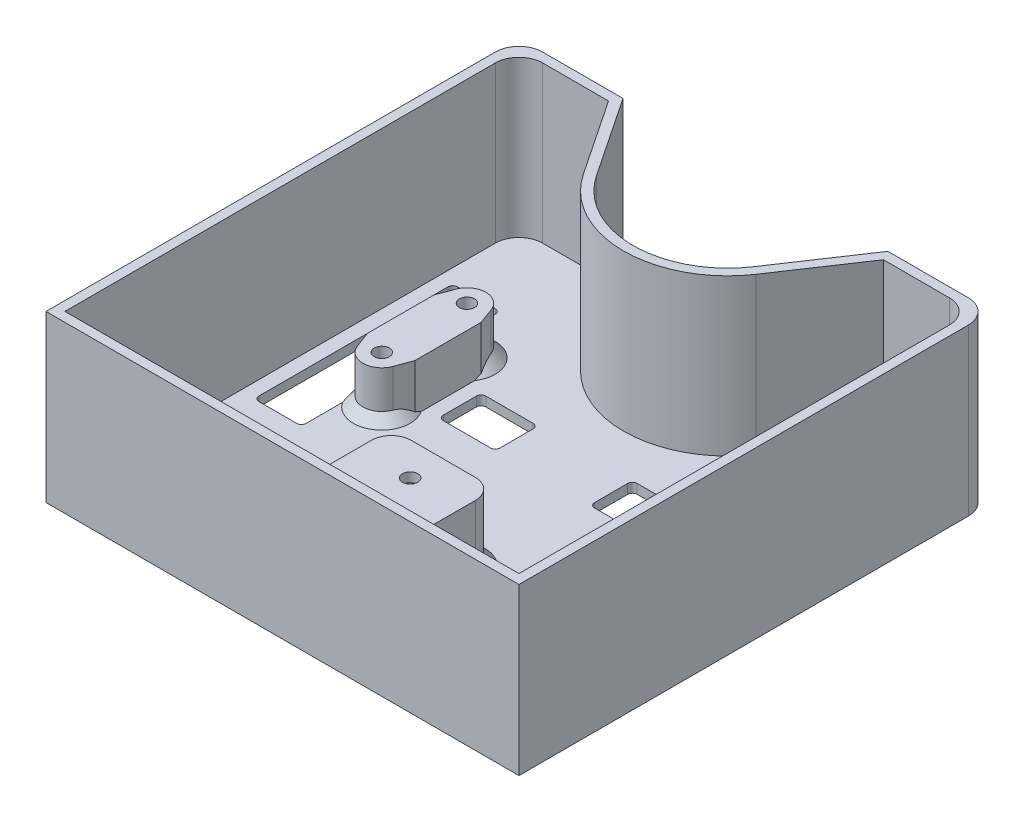
from build123d import *

# Parameters (mm, degrees)
AUFSATZ_LINEAR_AUSTRAGEN1_DEPTH = 35
WANDUNG1_T                      = -2
SKIZZE1_W                       = 10
SKIZZE1_H                       = 42
SCHNITT_LINEAR_AUSTRAGEN1_DEPTH = 2
SKIZZE2_R                       = 1.6
AUFSATZ_LINEAR_AUSTRAGEN2_DEPTH = 10
VERRUNDUNG1_R                   = 1
SKIZZE6_R                       = 1.6
SCHNITT_LINEAR_AUSTRAGEN2_DEPTH = 75.35724578
SCHNITT_LINEAR_AUSTRAGEN3_DEPTH = 9
FASE1_SIZE                      = 2
SKIZZE8_W                       = 12
SKIZZE8_H                       = 9
SCHNITT_LINEAR_AUSTRAGEN4_DEPTH = 2
VERRUNDUNG2_R                   = 1
VERRUNDUNG3_R                   = 5
VERRUNDUNG4_R                   = 5
SCHNITT_LINEAR_AUSTRAGEN5_REACH = 80.899
AUFSATZ_LINEAR_AUSTRAGEN3_DEPTH = 12
AUFSATZ_LINEAR_AUSTRAGEN4_DEPTH = 2
FASE2_SIZE                      = 2
SKIZZE13_R                      = 1.6
SCHNITT_LINEAR_AUSTRAGEN6_DEPTH = 2


# Some blends are built 0.0001 mm under size
with BuildPart() as part:
    # Grundplatte → Aufsatz-Linear austragen1 (new body)
    with BuildSketch(Plane(origin=(0, 0, 0), x_dir=(1, 0, 0), z_dir=(0, 1, 0))):
        with BuildLine():
            Line((-50, 50), (-50, -50))
            Line((-50, -50), (50, -50))
            Line((50, -50), (50, 50))
            Line((50, 50), (28, 50))
            Line((28, 50), (16.61985221, 33))
            ThreePointArc((16.61985221, 33), (0, 24.125669082), (-16.61985221, 33))
            Line((-16.61985221, 33), (-28, 50))
            Line((-28, 50), (-50, 50))
        make_face()
    extrude(amount=AUFSATZ_LINEAR_AUSTRAGEN1_DEPTH)

    # Wandung1
    wandung1_openings = [part.faces().sort_by_distance(p)[0] for p in [
        (0, 35, 4.219695438),
    ]]
    offset(amount=WANDUNG1_T, openings=wandung1_openings, kind=Kind.INTERSECTION)

    # Skizze1 → Schnitt-Linear austragen1 (cut)
    with BuildSketch(Plane(origin=(0, 2, 0), x_dir=(1, 0, 0), z_dir=(0, 1, 0))):
        with Locations((-40, 10)):
            Rectangle(SKIZZE1_W, SKIZZE1_H)
        with Locations((40, 10)):
            Rectangle(SKIZZE1_W, SKIZZE1_H)
    extrude(amount=-SCHNITT_LINEAR_AUSTRAGEN1_DEPTH, mode=Mode.SUBTRACT)

    # Skizze2 → Aufsatz-Linear austragen2 (add)
    # profile 1 of 2: a face of its own
    with BuildSketch(Plane(origin=(0, 2, 0), x_dir=(1, 0, 0), z_dir=(0, 1, 0))):
        with BuildLine():
            Line((-35, 16), (-35, 4))
            Line((-35, 4), (-35, 3))
            Line((-35, 3), (-33.753255524, -0.383138811))
            ThreePointArc((-33.753255524, -0.383138811), (-30, -3), (-26.246744476, -0.383138811))
            Line((-26.246744476, -0.383138811), (-25, 3))
            Line((-25, 3), (-25, 4))
            Line((-25, 4), (-25, 16))
            Line((-25, 16), (-25, 17))
            Line((-25, 17), (-26.246744476, 20.383138811))
            ThreePointArc((-26.246744476, 20.383138811), (-30, 23), (-33.753255524, 20.383138811))
            Line((-33.753255524, 20.383138811), (-35, 17))
            Line((-35, 17), (-35, 16))
        make_face()
        with Locations(Location((-30, 19, 0), (0, 0, 270))):
            Circle(SKIZZE2_R, mode=Mode.SUBTRACT)
        with Locations(Location((-30, 1, 0), (0, 0, 270))):
            Circle(SKIZZE2_R, mode=Mode.SUBTRACT)
    # profile 2 of 2: a face of its own
    with BuildSketch(Plane(origin=(0, 2, 0), x_dir=(1, 0, 0), z_dir=(0, 1, 0))):
        with BuildLine():
            Line((35, 16), (35, 17))
            Line((35, 17), (33.753255524, 20.383138811))
            ThreePointArc((33.753255524, 20.383138811), (30, 23), (26.246744476, 20.383138811))
            Line((26.246744476, 20.383138811), (25, 17))
            Line((25, 17), (25, 16))
            Line((25, 16), (25, 4))
            Line((25, 4), (25, 3))
            Line((25, 3), (26.246744476, -0.383138811))
            ThreePointArc((26.246744476, -0.383138811), (30, -3), (33.753255524, -0.383138811))
            Line((33.753255524, -0.383138811), (35, 3))
            Line((35, 3), (35, 4))
            Line((35, 4), (35, 16))
        make_face()
        with Locations(Location((30, 1, 0), (0, 0, 90))):
            Circle(SKIZZE2_R, mode=Mode.SUBTRACT)
        with Locations(Location((30, 19, 0), (0, 0, 90))):
            Circle(SKIZZE2_R, mode=Mode.SUBTRACT)
    extrude(amount=AUFSATZ_LINEAR_AUSTRAGEN2_DEPTH)

    # Verrundung1
    verrundung1_edges = [part.edges().sort_by_distance(p)[0] for p in [
        (-35, 1, -31),
        (-35, 1, 11),
        (-45, 1, 11),
        (-45, 1, -31),
        (45, 1, -31),
        (45, 1, 11),
        (35, 1, 11),
        (35, 1, -31),
    ]]
    fillet(verrundung1_edges, radius=VERRUNDUNG1_R)

    # Skizze6 → Schnitt-Linear austragen2 (cut, through all)
    with BuildSketch(Plane(origin=(0, 12, 0), x_dir=(1, 0, 0), z_dir=(0, 1, 0))):
        with Locations(Location((-30, 19, 0), (0, 0, 270))):
            Circle(SKIZZE6_R)
        with Locations(Location((-30, 1, 0), (0, 0, 270))):
            Circle(SKIZZE6_R)
        with Locations(Location((30, 19, 0), (0, 0, 90))):
            Circle(SKIZZE6_R)
        with Locations(Location((30, 1, 0), (0, 0, 90))):
            Circle(SKIZZE6_R)
    extrude(amount=-SCHNITT_LINEAR_AUSTRAGEN2_DEPTH, mode=Mode.SUBTRACT)

    # Skizze7 → Schnitt-Linear austragen3 (cut)
    with BuildSketch(Plane.XZ):
        Polygon((-26.709103466, -1), (-28.354551733, 1.85), (-31.645448267, 1.85), (-33.290896534, -1), (-31.645448267, -3.85), (-28.354551733, -3.85), align=None)
        Polygon((28.354551733, -21.85), (26.709103466, -19), (28.354551733, -16.15), (31.645448267, -16.15), (33.290896534, -19), (31.645448267, -21.85), align=None)
        Polygon((-26.709103466, -19), (-28.354551733, -16.15), (-31.645448267, -16.15), (-33.290896534, -19), (-31.645448267, -21.85), (-28.354551733, -21.85), align=None)
        Polygon((28.354551733, -3.85), (26.709103466, -1), (28.354551733, 1.85), (31.645448267, 1.85), (33.290896534, -1), (31.645448267, -3.85), align=None)
    extrude(amount=-SCHNITT_LINEAR_AUSTRAGEN3_DEPTH, mode=Mode.SUBTRACT)

    # Fase1
    # the kernel refuses this chamfer: 2 mm, written as the material it adds along each edge
    with BuildSketch(Plane(origin=(33.753255524, 2, 0.383138811), x_dir=(0.9379591204561566, -0.02749587661058633, 0.3456539673177909), z_dir=(0.3457847026662013, 0, -0.9383138810664834))) as fase1_piece_1_section:
        Polygon((FASE1_SIZE * 0.999621916911, -FASE1_SIZE * 0.0274958766106), (-FASE1_SIZE * 0.0274958766106, -FASE1_SIZE * 0.999621916911), (0, 0), align=None)
    fase1_piece_1 = extrude(amount=8.748917251, mode=Mode.PRIVATE)
    fase1_piece_1 = split(fase1_piece_1, bisect_by=Plane(origin=(35, 2.810043693, -0.69339811), z_dir=(-1, 0, 0)), keep=Keep.TOP, mode=Mode.PRIVATE)
    add(fase1_piece_1)
    with BuildSketch(Plane(origin=(30, 2, -1), x_dir=(-0.5946157089023157, 0, -0.8040100488965276), z_dir=(0.8040100488965276, 0, -0.5946157089023157))) as fase1_piece_2_section:
        Polygon((4 + FASE1_SIZE, 0), (4, FASE1_SIZE), (4, 0), align=None)
    fase1_piece_2 = revolve(axis=Axis((30, 2, -1), (0, 1, 0)), revolution_arc=213.285054007, mode=Mode.PRIVATE)
    fase1_piece_2 = split(fase1_piece_2, bisect_by=Plane(origin=(35, 2.618842305, 0.921149391), z_dir=(-1, 0, 0)), keep=Keep.TOP, mode=Mode.PRIVATE)
    add(fase1_piece_2)
    with BuildSketch(Plane(origin=(36.778497275, 2, -12.173908309), x_dir=(0.937959120456157, -0.027495876610586348, -0.34565396731779), z_dir=(-0.34578470266620037, 0, -0.9383138810664838))) as fase1_piece_3_section:
        Polygon((FASE1_SIZE * 0.999621916911, -FASE1_SIZE * 0.0274958766106), (-FASE1_SIZE * 0.0274958766106, -FASE1_SIZE * 0.999621916911), (0, 0), align=None)
    fase1_piece_3 = extrude(amount=8.748917251, mode=Mode.PRIVATE)
    fase1_piece_3 = split(fase1_piece_3, bisect_by=Plane(origin=(35, 2.810043693, -19.30660189), z_dir=(-1, 0, 0)), keep=Keep.TOP, mode=Mode.PRIVATE)
    add(fase1_piece_3)
    with BuildSketch(Plane(origin=(30, 2, -19), x_dir=(0.9383138810664835, 0, -0.3457847026662016), z_dir=(0.3457847026662016, 0, 0.9383138810664835))) as fase1_piece_4_section:
        Polygon((4 + FASE1_SIZE, 0), (4, FASE1_SIZE), (4, 0), align=None)
    fase1_piece_4 = revolve(axis=Axis((30, 2, -19), (0, 1, 0)), revolution_arc=213.285054007, mode=Mode.PRIVATE)
    fase1_piece_4 = split(fase1_piece_4, bisect_by=Plane(origin=(35, 2.568302244, -21.912371656), z_dir=(-1, 0, 0)), keep=Keep.TOP, mode=Mode.PRIVATE)
    add(fase1_piece_4)
    with BuildSketch(Plane(origin=(-33.753255524, 2, -20.383138811), x_dir=(-0.9379591204561563, -0.02749587661058632, -0.34565396731779174), z_dir=(-0.34578470266620215, 0, 0.9383138810664832))) as fase1_piece_5_section:
        Polygon((FASE1_SIZE * 0.999621916911, -FASE1_SIZE * 0.0274958766106), (-FASE1_SIZE * 0.0274958766106, -FASE1_SIZE * 0.999621916911), (0, 0), align=None)
    fase1_piece_5 = extrude(amount=8.748917251, mode=Mode.PRIVATE)
    fase1_piece_5 = split(fase1_piece_5, bisect_by=Plane(origin=(-35, 2.810043693, -19.30660189), z_dir=(1, 0, 0)), keep=Keep.TOP, mode=Mode.PRIVATE)
    add(fase1_piece_5)
    with BuildSketch(Plane(origin=(-30, 2, -19), x_dir=(0.5946157089023089, 0, 0.8040100488965327), z_dir=(-0.8040100488965327, 0, 0.5946157089023089))) as fase1_piece_6_section:
        Polygon((4 + FASE1_SIZE, 0), (4, FASE1_SIZE), (4, 0), align=None)
    fase1_piece_6 = revolve(axis=Axis((-30, 2, -19), (0, 1, 0)), revolution_arc=213.285054007, mode=Mode.PRIVATE)
    fase1_piece_6 = split(fase1_piece_6, bisect_by=Plane(origin=(-35, 2.618842305, -20.921149391), z_dir=(1, 0, 0)), keep=Keep.TOP, mode=Mode.PRIVATE)
    add(fase1_piece_6)
    with BuildSketch(Plane(origin=(-36.778497275, 2, -7.826091691), x_dir=(-0.937959120456156, -0.02749587661058632, 0.3456539673177927), z_dir=(0.3457847026662031, 0, 0.9383138810664828))) as fase1_piece_7_section:
        Polygon((FASE1_SIZE * 0.999621916911, -FASE1_SIZE * 0.0274958766106), (-FASE1_SIZE * 0.0274958766106, -FASE1_SIZE * 0.999621916911), (0, 0), align=None)
    fase1_piece_7 = extrude(amount=8.748917251, mode=Mode.PRIVATE)
    fase1_piece_7 = split(fase1_piece_7, bisect_by=Plane(origin=(-35, 2.810043693, -0.69339811), z_dir=(1, 0, 0)), keep=Keep.TOP, mode=Mode.PRIVATE)
    add(fase1_piece_7)
    with BuildSketch(Plane(origin=(-30, 2, -1), x_dir=(-0.9383138810664808, 0, 0.34578470266620803), z_dir=(-0.34578470266620803, 0, -0.9383138810664808))) as fase1_piece_8_section:
        Polygon((4 + FASE1_SIZE, 0), (4, FASE1_SIZE), (4, 0), align=None)
    fase1_piece_8 = revolve(axis=Axis((-30, 2, -1), (0, 1, 0)), revolution_arc=213.285054007, mode=Mode.PRIVATE)
    fase1_piece_8 = split(fase1_piece_8, bisect_by=Plane(origin=(-35, 2.568302244, 1.912371656), z_dir=(1, 0, 0)), keep=Keep.TOP, mode=Mode.PRIVATE)
    add(fase1_piece_8)

    # Skizze8 → Schnitt-Linear austragen4 (cut)
    with BuildSketch(Plane.XZ):
        with Locations((16, -9.5)):
            Rectangle(SKIZZE8_W, SKIZZE8_H)
        with Locations((-16, -9.5)):
            Rectangle(SKIZZE8_W, SKIZZE8_H)
    extrude(amount=-SCHNITT_LINEAR_AUSTRAGEN4_DEPTH, mode=Mode.SUBTRACT)

    # Verrundung2
    verrundung2_edges = [part.edges().sort_by_distance(p)[0] for p in [
        (-10, 1, -14),
        (-10, 1, -5),
        (-22, 1, -5),
        (-22, 1, -14),
        (10, 1, -5),
        (10, 1, -14),
        (22, 1, -14),
        (22, 1, -5),
    ]]
    fillet(verrundung2_edges, radius=VERRUNDUNG2_R)

    # Verrundung3
    verrundung3_edges = [part.edges().sort_by_distance(p)[0] for p in [
        (-50, 17.5, -50),
        (50, 17.5, -50),
    ]]
    fillet(verrundung3_edges, radius=VERRUNDUNG3_R)

    # Verrundung4
    verrundung4_edges = [part.edges().sort_by_distance(p)[0] for p in [
        (48, 18.5, -48),
        (-48, 18.5, -48),
    ]]
    fillet(verrundung4_edges, radius=VERRUNDUNG4_R)

    # Skizze9 → Schnitt-Linear austragen5 (cut, up to next)
    with BuildSketch(Plane.XZ, mode=Mode.PRIVATE) as schnitt_linear_austragen5_sk1:
        with BuildLine():
            Line((-6.8, 43), (6.8, 43))
            ThreePointArc((6.8, 43), (7.648528137, 42.648528137), (8, 41.8))
            Line((8, 41.8), (8, 20.2))
            ThreePointArc((8, 20.2), (7.648528137, 19.351471863), (6.8, 19))
            Line((6.8, 19), (-6.8, 19))
            ThreePointArc((-6.8, 19), (-7.648528137, 19.351471863), (-8, 20.2))
            Line((-8, 20.2), (-8, 41.8))
            ThreePointArc((-8, 41.8), (-7.648528137, 42.648528137), (-6.8, 43))
        make_face()
    schnitt_linear_austragen5_tool1 = extrude(schnitt_linear_austragen5_sk1.sketch, amount=-SCHNITT_LINEAR_AUSTRAGEN5_REACH, mode=Mode.PRIVATE) & part.part
    add(schnitt_linear_austragen5_tool1.solids().sort_by_distance((0, 0, 31))[0], mode=Mode.SUBTRACT)

    # Skizze11 → Aufsatz-Linear austragen3 (add)
    with BuildSketch(Plane(origin=(0, 2, 0), x_dir=(1, 0, 0), z_dir=(0, 1, 0))):
        with BuildLine():
            Line((-6.8, -46), (6.8, -46))
            ThreePointArc((6.8, -46), (9.769848481, -44.769848481), (11, -41.8))
            Line((11, -41.8), (11, -20.2))
            ThreePointArc((11, -20.2), (9.769848481, -17.230151519), (6.8, -16))
            Line((6.8, -16), (-6.8, -16))
            ThreePointArc((-6.8, -16), (-9.769848481, -17.230151519), (-11, -20.2))
            Line((-11, -20.2), (-11, -41.8))
            ThreePointArc((-11, -41.8), (-9.769848481, -44.769848481), (-6.8, -46))
        make_face()
        with BuildLine():
            Line((-8, -20.2), (-8, -41.8))
            ThreePointArc((-8, -41.8), (-7.648528137, -42.648528137), (-6.8, -43))
            Line((-6.8, -43), (6.8, -43))
            ThreePointArc((6.8, -43), (7.648528137, -42.648528137), (8, -41.8))
            Line((8, -41.8), (8, -20.2))
            ThreePointArc((8, -20.2), (7.648528137, -19.351471863), (6.8, -19))
            Line((6.8, -19), (-6.8, -19))
            ThreePointArc((-6.8, -19), (-7.648528137, -19.351471863), (-8, -20.2))
        make_face(mode=Mode.SUBTRACT)
    extrude(amount=AUFSATZ_LINEAR_AUSTRAGEN3_DEPTH)

    # Skizze12 → Aufsatz-Linear austragen4 (add)
    with BuildSketch(Plane(origin=(0, 14, 0), x_dir=(1, 0, 0), z_dir=(0, 1, 0))):
        with BuildLine():
            Line((11, -41.8), (11, -20.2))
            ThreePointArc((11, -20.2), (9.769848481, -17.230151519), (6.8, -16))
            Line((6.8, -16), (-6.8, -16))
            ThreePointArc((-6.8, -16), (-9.769848481, -17.230151519), (-11, -20.2))
            Line((-11, -20.2), (-11, -41.8))
            ThreePointArc((-11, -41.8), (-9.769848481, -44.769848481), (-6.8, -46))
            Line((-6.8, -46), (6.8, -46))
            ThreePointArc((6.8, -46), (9.769848481, -44.769848481), (11, -41.8))
        make_face()
    extrude(amount=AUFSATZ_LINEAR_AUSTRAGEN4_DEPTH)

    # Fase2
    fase2_edges = [part.edges().sort_by_distance(p)[0] for p in [
        (9.769848481, 2, 44.769848481),
        (11, 2, 31),
        (9.769848481, 2, 17.230151519),
        (0, 2, 16),
        (-9.769848481, 2, 17.230151519),
        (-11, 2, 31),
        (-9.769848481, 2, 44.769848481),
        (0, 2, 46),
    ]]
    chamfer(fase2_edges, length=FASE2_SIZE - 0.0001)  # a hair under: the kernel refuses the full size

    # Skizze13 → Schnitt-Linear austragen6 (cut)
    with BuildSketch(Plane(origin=(0, 16, 0), x_dir=(1, 0, 0), z_dir=(0, 1, 0))):
        with Locations(Location((0, -23, 0), (0, 0, 270))):
            Circle(SKIZZE13_R)
        with Locations(Location((0, -39, 0), (0, 0, 270))):
            Circle(SKIZZE13_R)
    extrude(amount=-SCHNITT_LINEAR_AUSTRAGEN6_DEPTH, mode=Mode.SUBTRACT)


solid = part.part
